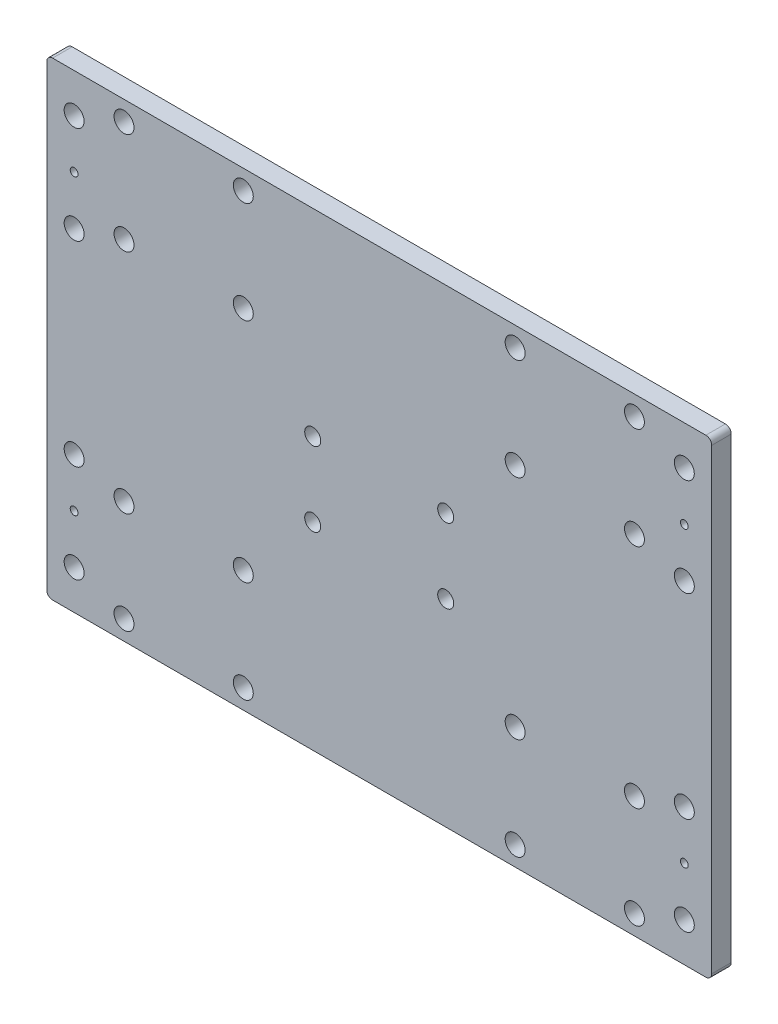
from build123d import *

# Parameters (mm, degrees)
SKETCH1_W           = 170
SKETCH1_H           = 120
BOSS_EXTRUDE1_DEPTH = 2.5
SKETCH2_R           = 2.55
CUT_EXTRUDE1_DEPTH  = 105.16333328
SKETCH4_R           = 2.05
CUT_EXTRUDE3_DEPTH  = 105.16333328
FILLET1_R           = 1.5
SKETCH6_R           = 2.55
SKETCH6_R_2         = 1
CUT_EXTRUDE5_DEPTH  = 105.16333328


with BuildPart() as part:
    # Sketch1 → Boss-Extrude1 (new, symmetric)
    with BuildSketch(Plane.XY):
        Rectangle(SKETCH1_W, SKETCH1_H)
    extrude(amount=BOSS_EXTRUDE1_DEPTH, both=True)

    # Sketch2 → Cut-Extrude1 (cut, through all)
    with BuildSketch(Plane.XY.offset(2.5)):
        with Locations((-65.25, 55)):
            Circle(SKETCH2_R)
        with Locations((-34.75, 55)):
            Circle(SKETCH2_R)
        with Locations((-34.75, 29)):
            Circle(SKETCH2_R)
        with Locations((-65.25, 29)):
            Circle(SKETCH2_R)
        with Locations((65.25, 55)):
            Circle(SKETCH2_R)
        with Locations((65.25, 29)):
            Circle(SKETCH2_R)
        with Locations((34.75, 29)):
            Circle(SKETCH2_R)
        with Locations((34.75, 55)):
            Circle(SKETCH2_R)
        with Locations((-65.25, -29)):
            Circle(SKETCH2_R)
        with Locations((-34.75, -29)):
            Circle(SKETCH2_R)
        with Locations((-34.75, -55)):
            Circle(SKETCH2_R)
        with Locations((-65.25, -55)):
            Circle(SKETCH2_R)
        with Locations((34.75, -29)):
            Circle(SKETCH2_R)
        with Locations((65.25, -29)):
            Circle(SKETCH2_R)
        with Locations((65.25, -55)):
            Circle(SKETCH2_R)
        with Locations((34.75, -55)):
            Circle(SKETCH2_R)
    extrude(amount=-CUT_EXTRUDE1_DEPTH, mode=Mode.SUBTRACT)

    # Sketch4 → Cut-Extrude3 (cut, through all)
    with BuildSketch(Plane.XY.offset(2.5)):
        with Locations((-17, 9.5)):
            Circle(SKETCH4_R)
        with Locations((-17, -9.5)):
            Circle(SKETCH4_R)
        with Locations((17, -9.5)):
            Circle(SKETCH4_R)
        with Locations((17, 9.5)):
            Circle(SKETCH4_R)
    extrude(amount=-CUT_EXTRUDE3_DEPTH, mode=Mode.SUBTRACT)

    # Fillet1
    fillet1_edges = [part.edges().sort_by_distance(p)[0] for p in [
        (-85, -60, 0),
        (85, -60, 0),
        (85, 60, 0),
        (-85, 60, 0),
    ]]
    fillet(fillet1_edges, radius=FILLET1_R)

    # Sketch6 → Cut-Extrude5 (cut, through all)
    with BuildSketch(Plane.XY.offset(2.5)):
        with Locations((-78, 50)):
            Circle(SKETCH6_R)
        with Locations((-78, 37.5)):
            Circle(SKETCH6_R_2)
        with Locations((-78, 25)):
            Circle(SKETCH6_R)
        with Locations((-78, -25)):
            Circle(SKETCH6_R)
        with Locations((-78, -37.5)):
            Circle(SKETCH6_R_2)
        with Locations((-78, -50)):
            Circle(SKETCH6_R)
    cut_extrude5 = extrude(amount=-CUT_EXTRUDE5_DEPTH, mode=Mode.SUBTRACT)

    # Mirror1: Cut-Extrude5 across plane
    add(cut_extrude5.mirror(Plane(origin=(0, 0, 0), x_dir=(0, 0, 1), z_dir=(1, 0, 0))), mode=Mode.SUBTRACT)


solid = part.part
